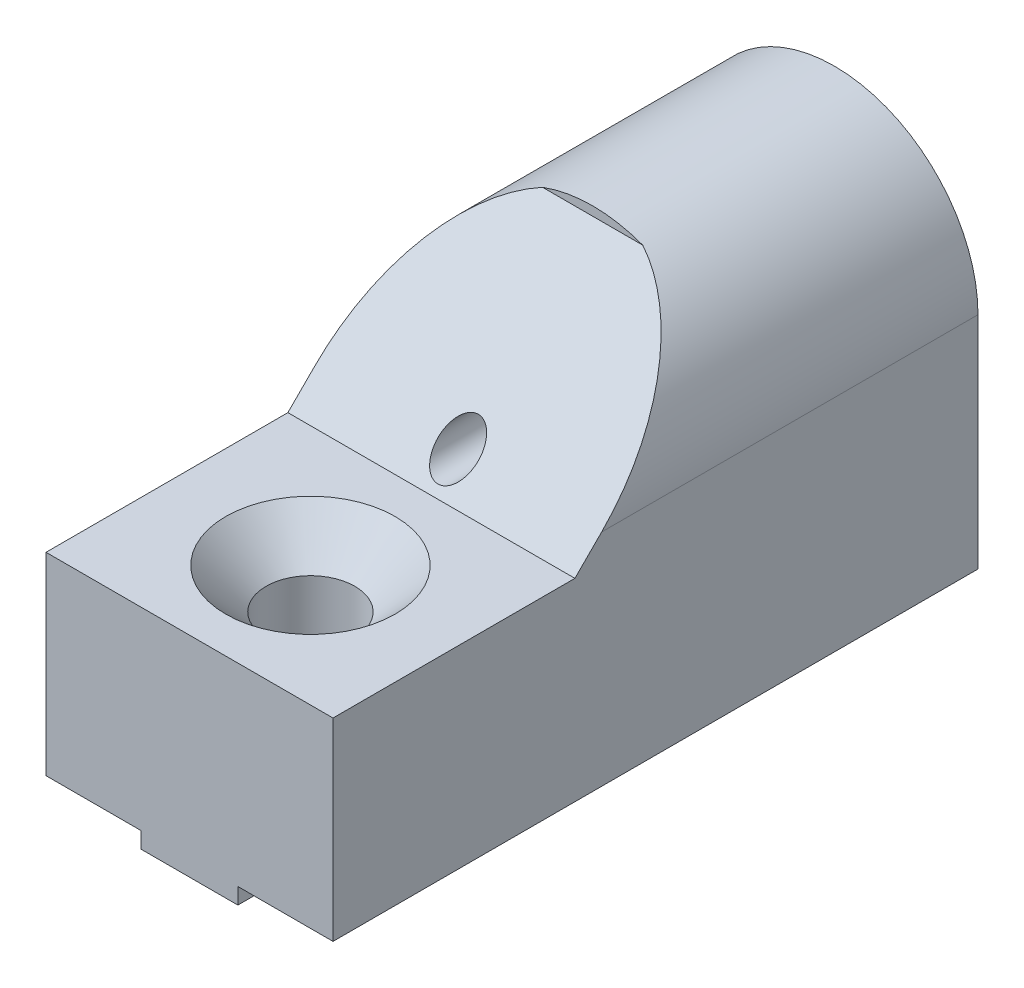
from build123d import *
from build123d.topology import SkipClean

# Parameters (mm, degrees)
SKETCH1_R           = 1.25
BOSS_EXTRUDE1_DEPTH = 15
SKETCH2_W           = 17.8
SKETCH2_H           = 12
BOSS_EXTRUDE2_DEPTH = 25
CHAMFER1_START      = 15
CHAMFER1_OUTLINE_R  = 1.25
CHAMFER1_DEPTH      = 10
CHAMFER1_START_2    = -10
CHAMFER1_2_DEPTH    = 20
SKETCH3_R           = 2.75
CUT_EXTRUDE1_DEPTH  = 43.699063222
CHAMFER2_SIZE       = 2.5
SKETCH4_W           = 6
SKETCH4_H           = 40
SKETCH4_R           = 2.75
BOSS_EXTRUDE3_DEPTH = 1


with BuildPart() as part:
    # Sketch1 → Boss-Extrude1 (new body)
    with BuildSketch(Plane.XY):
        with BuildLine():
            Line((-8.9, -13.66), (8.9, -13.66))
            Line((8.9, -13.66), (8.9, 0))
            ThreePointArc((8.9, 0), (0, 8.9), (-8.9, 0))
            Line((-8.9, 0), (-8.9, -13.66))
        make_face()
        Circle(SKETCH1_R, mode=Mode.SUBTRACT)
    extrude(amount=BOSS_EXTRUDE1_DEPTH)

    # Sketch2 → Boss-Extrude2 (add)
    with BuildSketch(Plane.XY.offset(15)):
        with Locations((0, -7.66)):
            Rectangle(SKETCH2_W, SKETCH2_H)
    extrude(amount=BOSS_EXTRUDE2_DEPTH)

    # Chamfer1: read off the stored shape, not the designer's step
    # Chamfer1 outline → Chamfer1 (add)
    with BuildSketch(Plane.XY.offset(CHAMFER1_START)):
        with BuildLine():
            Line((-8.9, 0), (-8.9, -1.66))
            Line((-8.9, -1.66), (8.9, -1.66))
            Line((8.9, -1.66), (8.9, 0))
            ThreePointArc((8.9, 0), (0, 8.9), (-8.9, 0))
        make_face()
        Circle(CHAMFER1_OUTLINE_R, mode=Mode.SUBTRACT)
    extrude(amount=CHAMFER1_DEPTH)

    # Chamfer1 2 outline → Chamfer1 2 (cut)
    with BuildSketch(Plane.YZ.offset(CHAMFER1_START_2)):
        Polygon((-1.66, 25), (8.34, 15), (10, 15), (10, 25), align=None)
    extrude(amount=CHAMFER1_2_DEPTH, mode=Mode.SUBTRACT)

    # Sketch3 → Cut-Extrude1 (cut, through all)
    with BuildSketch(Plane(origin=(0, -1.66, 0), x_dir=(1, 0, 0), z_dir=(0, 1, 0))):
        with Locations(Location((0, -32.5, 0), (0, 0, 270))):
            Circle(SKETCH3_R)
    extrude(amount=-CUT_EXTRUDE1_DEPTH, mode=Mode.SUBTRACT)

    # Chamfer2
    chamfer2_edges = [part.edges().sort_by_distance(p)[0] for p in [
        (0, -1.66, 29.75),
    ]]
    chamfer(chamfer2_edges, length=CHAMFER2_SIZE)

    # Sketch4 → Boss-Extrude3 (add)
    with SkipClean():  # the faces are left unmerged after this step: merging them gives an invalid solid
        with BuildSketch(Plane.XZ.offset(13.66)):
            with Locations((0, 20)):
                Rectangle(SKETCH4_W, SKETCH4_H)
            with Locations(Location((0, 32.5, 0), (0, 0, 270))):
                Circle(SKETCH4_R, mode=Mode.SUBTRACT)
        extrude(amount=BOSS_EXTRUDE3_DEPTH)


solid = part.part
